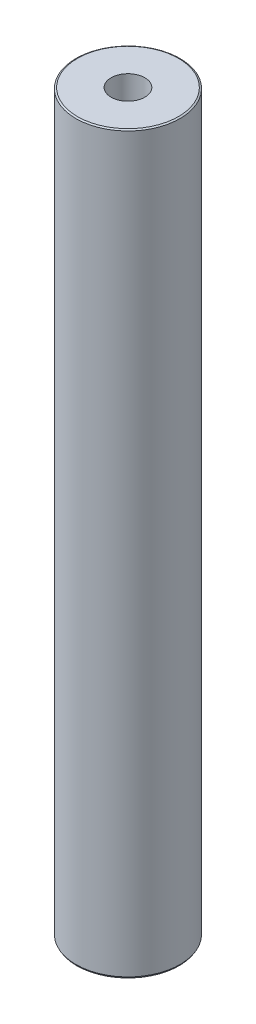
from build123d import *
from OCP.BRepFilletAPI import BRepFilletAPI_MakeChamfer

# Parameters (mm, degrees)
SKETCH1_R           = 42.5
BOSS_EXTRUDE1_DEPTH = 600
SKETCH2_R           = 13.781339388
CUT_EXTRUDE1_DEPTH  = 604.002902149
CHAMFER1_SIZE       = 0.74073459
CHAMFER1_SIZE2      = 1.282989945


with BuildPart() as part:
    # Sketch1 → Boss-Extrude1 (new body)
    with BuildSketch(Plane(origin=(0, 0, 0), x_dir=(1, 0, 0), z_dir=(0, 1, 0))):
        Circle(SKETCH1_R)
    extrude(amount=BOSS_EXTRUDE1_DEPTH)

    # Sketch2 → Cut-Extrude1 (cut, through all)
    with BuildSketch(Plane(origin=(0, 0, 0), x_dir=(1, 0, 0), z_dir=(0, 1, 0))):
        Circle(SKETCH2_R)
    extrude(amount=CUT_EXTRUDE1_DEPTH, mode=Mode.SUBTRACT)

    # Chamfer1: one chamfer whose edges measure the first distance from different faces: ONE call of the kernel's chamfer builder (chamfer() names one face for all edges)
    chamfer1_edges_1 = [part.edges().sort_by_distance(p)[0] for p in [
        (-42.5, 600, 0),
    ]]
    chamfer1_side_1 = [part.faces().sort_by_distance(p)[0] for p in [
        (-42.5, 300, 0),
    ]]
    chamfer1_edges_2 = [part.edges().sort_by_distance(p)[0] for p in [
        (-42.5, 0, 0),
    ]]
    chamfer1_side_2 = [part.faces().sort_by_distance(p)[0] for p in [
        (-41.297918472, 0, 0),
    ]]
    chamfer1 = BRepFilletAPI_MakeChamfer(part.part.solid().wrapped)
    for e in chamfer1_edges_1:
        chamfer1.Add(CHAMFER1_SIZE, CHAMFER1_SIZE2, e.wrapped, chamfer1_side_1[0].wrapped)  # the first distance lies on this face
    for e in chamfer1_edges_2:
        chamfer1.Add(CHAMFER1_SIZE, CHAMFER1_SIZE2, e.wrapped, chamfer1_side_2[0].wrapped)  # the first distance lies on this face
    add(Compound.cast(chamfer1.Shape()), mode=Mode.REPLACE)


solid = part.part
